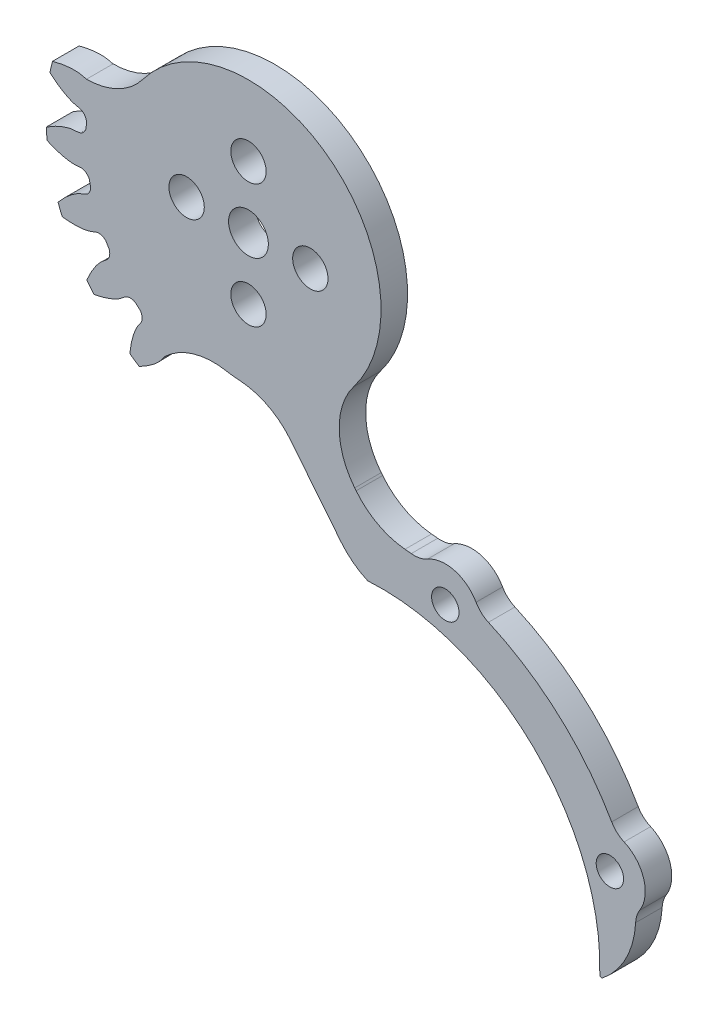
from build123d import *
from build123d.topology import SkipClean

# Parameters (mm, degrees)
SKETCH_1_R               = 23
EXTRUDE_1_DEPTH          = 3
CUT_EXTRUDE_1_DEPTH      = 33.664965942
PATTERN_CIRCULAR_1_COUNT = 21
SKETCH_4_R               = 2.1
CUT_EXTRUDE_2_DEPTH      = 10
SKETCH_5_R               = 2
CUT_EXTRUDE_3_DEPTH      = 10
SKETCH_10_R              = 30.47238685
CUT_EXTRUDE_5_DEPTH      = 3
CUT_EXTRUDE_6_DEPTH      = 3
EXTRUDE_2_DEPTH          = 3
CUT_EXTRUDE_7_DEPTH      = 10
SKETCH_14_R              = 1.55
CUT_EXTRUDE_8_DEPTH      = 10
FILLET_1_R               = 8
FILLET_2_R               = 8
FILLET_3_R               = 10
EXTRUDE_START            = -3
EXTRUDE_3_DEPTH          = 3
FILLET_5_R               = 3
FILLET_6_DEPTH           = 3
SKETCH_16_R              = 2.25
CUT_EXTRUDE_9_DEPTH      = 10
FILLET_7_R               = 0.2
SKETCH_18_R              = 1
CUT_EXTRUDE_10_DEPTH     = 1


with BuildPart() as part:
    # 草图1 → 凸台-拉伸1 (new body)
    with BuildSketch(Plane.XY):
        Circle(SKETCH_1_R)
    extrude(amount=EXTRUDE_1_DEPTH)

    # 草图2 → 切除-拉伸1 (cut, through all)
    with BuildSketch(Plane.XY):
        with BuildLine():
            ThreePointArc((0.379318728, 18.49611087), (0, 18.5), (-0.379318728, 18.49611087))
            add(Edge.make_bspline(
                [(-0.379318728, 18.49611087), (-1.198551585, 18.770207731), (-1.105588756, 19.339069889), (-1.212479371, 19.891707565), (-1.22485173, 19.949603647), (-1.240186203, 20.014925389), (-1.258774323, 20.0875763), (-1.280917681, 20.167448705), (-1.30691073, 20.254426612), (-1.337045923, 20.34838491), (-1.371611795, 20.449189724), (-1.410893244, 20.55669843), (-1.455171142, 20.670759774), (-1.504722148, 20.791213969), (-1.559818468, 20.917892808), (-1.620727631, 21.050619779), (-1.687712268, 21.189210182), (-1.76102989, 21.333471261), (-1.84093267, 21.483202333), (-1.927667235, 21.638194926), (-2.021474449, 21.798232922), (-2.122589211, 21.963092704), (-2.231240251, 22.132543311), (-2.347649931, 22.306346595), (-2.472034047, 22.484257387), (-2.604601644, 22.66602366), (-2.745554822, 22.851386709), (-2.895088556, 23.040081322), (-3.053390519, 23.231835969), (-3.220640907, 23.426372983), (-3.397012266, 23.623408757), (-3.582669333, 23.822653935), (-3.777768872, 24.023813614), (-3.98245952, 24.226587551), (-4.196881638, 24.430670364), (-4.421167165, 24.635751752), (-4.655439476, 24.841516702), (-4.899813249, 25.047645717), (-5.154394351, 25.253815031), (-5.419279639, 25.459696844), (-5.7905351, 25.736526212), (-6.078424351, 25.937901448), (-6.275082174, 26.069812755)],
                knots=[0, 0, 0, 0, 0.161234605, 0.166476889, 0.172525678, 0.179380972, 0.187042772, 0.195511076, 0.204785886, 0.214867201, 0.225755021, 0.237449346, 0.249950177, 0.263257512, 0.277371353, 0.292291699, 0.30801855, 0.324551907, 0.341891768, 0.360038135, 0.378991007, 0.398750384, 0.419316266, 0.440688653, 0.462867546, 0.485852944, 0.509644847, 0.534243255, 0.559648168, 0.585859587, 0.612877511, 0.64070194, 0.669332874, 0.698770313, 0.729014258, 0.760064707, 0.791921662, 0.824585122, 0.858055087, 0.892331558, 0.927414533, 1, 1, 1, 1], degree=3))
            ThreePointArc((-6.275082174, 26.069812755), (0, 26.814395264), (6.275082174, 26.069812755))
            add(Edge.make_bspline(
                [(0.379318728, 18.49611087), (1.198551585, 18.770207731), (1.105588756, 19.339069889), (1.212479371, 19.891707565), (1.22485173, 19.949603647), (1.240186203, 20.014925389), (1.258774323, 20.0875763), (1.280917681, 20.167448705), (1.30691073, 20.254426612), (1.337045923, 20.34838491), (1.371611795, 20.449189724), (1.410893244, 20.55669843), (1.455171142, 20.670759774), (1.504722148, 20.791213969), (1.559818468, 20.917892808), (1.620727631, 21.050619779), (1.687712268, 21.189210182), (1.76102989, 21.333471261), (1.84093267, 21.483202333), (1.927667235, 21.638194926), (2.021474449, 21.798232922), (2.122589211, 21.963092704), (2.231240251, 22.132543311), (2.347649931, 22.306346595), (2.472034047, 22.484257387), (2.604601644, 22.66602366), (2.745554822, 22.851386709), (2.895088556, 23.040081322), (3.053390519, 23.231835969), (3.220640907, 23.426372983), (3.397012266, 23.623408757), (3.582669333, 23.822653935), (3.777768872, 24.023813614), (3.98245952, 24.226587551), (4.196881638, 24.430670364), (4.421167165, 24.635751752), (4.655439476, 24.841516702), (4.899813249, 25.047645717), (5.154394351, 25.253815031), (5.419279639, 25.459696844), (5.7905351, 25.736526212), (6.078424351, 25.937901448), (6.275082174, 26.069812755)],
                knots=[0, 0, 0, 0, 0.161234605, 0.166476889, 0.172525678, 0.179380972, 0.187042772, 0.195511076, 0.204785886, 0.214867201, 0.225755021, 0.237449346, 0.249950177, 0.263257512, 0.277371353, 0.292291699, 0.30801855, 0.324551907, 0.341891768, 0.360038135, 0.378991007, 0.398750384, 0.419316266, 0.440688653, 0.462867546, 0.485852944, 0.509644847, 0.534243255, 0.559648168, 0.585859587, 0.612877511, 0.64070194, 0.669332874, 0.698770313, 0.729014258, 0.760064707, 0.791921662, 0.824585122, 0.858055087, 0.892331558, 0.927414533, 1, 1, 1, 1], degree=3))
        make_face()
    cut_extrude_1 = extrude(amount=CUT_EXTRUDE_1_DEPTH, mode=Mode.SUBTRACT)

    # 阵列(圆周)1: 切除-拉伸1 ×21 about axis
    pattern_circular_1_axis = Axis((0, 0, -0.15), (0, 0, 1))
    for i in range(1, PATTERN_CIRCULAR_1_COUNT):
        add(cut_extrude_1.rotate(pattern_circular_1_axis, i * 360 / PATTERN_CIRCULAR_1_COUNT), mode=Mode.SUBTRACT)

    # 草图4 → 切除-拉伸2 (cut)
    with BuildSketch(Plane(origin=(0, 0, 0), x_dir=(-1, 0, 0), z_dir=(0, 0, -1))):
        Circle(SKETCH_4_R)
    extrude(amount=-CUT_EXTRUDE_2_DEPTH, mode=Mode.SUBTRACT)

    # 草图5 → 切除-拉伸3 (cut)
    with BuildSketch(Plane(origin=(0, 0, 0), x_dir=(-1, 0, 0), z_dir=(0, 0, -1))):
        with Locations((0, 7)):
            Circle(SKETCH_5_R)
        with Locations((7, 0)):
            Circle(SKETCH_5_R)
        with Locations((0, -7)):
            Circle(SKETCH_5_R)
        with Locations((-7, 0)):
            Circle(SKETCH_5_R)
    extrude(amount=-CUT_EXTRUDE_3_DEPTH, mode=Mode.SUBTRACT)

    # 草图10 → 切除-拉伸5 (cut)
    with BuildSketch(Plane(origin=(0, 0, 0), x_dir=(-1, 0, 0), z_dir=(0, 0, -1))):
        Circle(SKETCH_10_R)
        with BuildLine():
            ThreePointArc((5.799299087, 17.462191446), (5.423495209, 17.582539626), (5.04519693, 17.694801156))
            add(Edge.make_bspline(
                [(5.04519693, 17.694801156), (4.959309688, 17.756385518), (4.877646553, 17.822179648), (4.731987564, 17.971375216), (4.666440633, 18.055974702), (4.56655718, 18.242766467), (4.532957454, 18.344428107), (4.500758672, 18.554416434), (4.501841681, 18.660685726), (4.532974323, 18.979299828), (4.588542547, 19.189738719), (4.626274776, 19.614771365), (4.624151676, 19.828475731), (4.598651768, 20.257087475), (4.574045478, 20.471915252), (4.507855373, 20.89517708), (4.466103805, 21.104720101), (4.319361805, 21.728166575), (4.193050353, 22.136927542), (4.043750319, 22.540143818)],
                knots=[0, 0, 0, 0, 0.0625, 0.0625, 0.125, 0.125, 0.1875, 0.1875, 0.25, 0.25, 0.375, 0.375, 0.5, 0.5, 0.625, 0.625, 0.75, 0.75, 1, 1, 1, 1], degree=3))
            ThreePointArc((4.043750319, 22.540143818), (3.413067828, 22.644225931), (2.779726049, 22.730664819))
            add(Edge.make_bspline(
                [(2.779726049, 22.730664819), (2.519307935, 22.390806119), (2.278621276, 22.038423036), (1.846616689, 21.302320466), (1.653845637, 20.916867571), (1.429843368, 20.322205766), (1.365002114, 20.120929317), (1.296774474, 19.809985265), (1.281742042, 19.703939474), (1.255738717, 19.490584791), (1.243580624, 19.383775953), (1.202593621, 19.174488053), (1.173391994, 19.071112697), (1.082561974, 18.87678796), (1.021711992, 18.788376558), (0.870947674, 18.635443785), (0.783830889, 18.572950972), (0.595733957, 18.469416375), (0.496367024, 18.429823928), (0.394581215, 18.395768689)],
                knots=[0, 0, 0, 0, 0.25, 0.25, 0.5, 0.5, 0.625, 0.625, 0.6875, 0.6875, 0.75, 0.75, 0.8125, 0.8125, 0.875, 0.875, 0.9375, 0.9375, 1, 1, 1, 1], degree=3))
            ThreePointArc((0.394581215, 18.395768689), (0, 18.4), (-0.394581215, 18.395768689))
            add(Edge.make_bspline(
                [(-0.394581215, 18.395768689), (-0.494805037, 18.429301323), (-0.592233268, 18.468101772), (-0.775397203, 18.567735259), (-0.862968204, 18.629255929), (-1.013471954, 18.778307897), (-1.075544233, 18.865549302), (-1.168207659, 19.056717679), (-1.198496189, 19.158584946), (-1.262659838, 19.472220426), (-1.271588307, 19.689689129), (-1.360812987, 20.106960537), (-1.425832231, 20.310544822), (-1.576534779, 20.71259832), (-1.66336948, 20.91062907), (-1.851377557, 21.295576687), (-1.95303811, 21.483503809), (-2.277024849, 22.035999341), (-2.518209048, 22.389369251), (-2.779726184, 22.730664802)],
                knots=[0, 0, 0, 0, 0.0625, 0.0625, 0.125, 0.125, 0.1875, 0.1875, 0.25, 0.25, 0.375, 0.375, 0.5, 0.5, 0.625, 0.625, 0.75, 0.75, 1, 1, 1, 1], degree=3))
            ThreePointArc((-2.779726184, 22.730664802), (-3.413067963, 22.64422591), (-4.043750453, 22.540143794))
            add(Edge.make_bspline(
                [(-4.043750453, 22.540143794), (-4.19242381, 22.138624476), (-4.3185507, 21.730953148), (-4.514392493, 20.900217961), (-4.584985033, 20.475069392), (-4.623755865, 19.840800915), (-4.62638913, 19.629354319), (-4.599933239, 19.312114189), (-4.583040277, 19.206348827), (-4.54500095, 18.99480828), (-4.525136436, 18.889160998), (-4.50261381, 18.67709004), (-4.500047669, 18.569700031), (-4.529564145, 18.357235979), (-4.561651014, 18.2548166), (-4.66063957, 18.064239638), (-4.725465921, 17.978845082), (-4.874688876, 17.824467693), (-4.957971137, 17.75734531), (-5.04519693, 17.694801156)],
                knots=[0, 0, 0, 0, 0.25, 0.25, 0.5, 0.5, 0.625, 0.625, 0.6875, 0.6875, 0.75, 0.75, 0.8125, 0.8125, 0.875, 0.875, 0.9375, 0.9375, 1, 1, 1, 1], degree=3))
            ThreePointArc((-5.04519693, 17.694801156), (-5.423495209, 17.582539626), (-5.799299087, 17.462191446))
            add(Edge.make_bspline(
                [(-5.799299087, 17.462191446), (-5.904954163, 17.464692829), (-6.009490565, 17.473052008), (-6.213884525, 17.51427054), (-6.315698528, 17.547246015), (-6.503449658, 17.645314262), (-6.588479095, 17.710383651), (-6.733373614, 17.865745929), (-6.792342414, 17.954159819), (-6.946101132, 18.234948787), (-7.018732959, 18.440124253), (-7.226986544, 18.812558026), (-7.349124687, 18.987932875), (-7.611639292, 19.327703908), (-7.752986759, 19.49134173), (-8.046107468, 19.803770851), (-8.198644019, 19.953383924), (-8.671087853, 20.385836862), (-9.005714524, 20.652417248), (-9.356211817, 20.901466466)],
                knots=[0, 0, 0, 0, 0.0625, 0.0625, 0.125, 0.125, 0.1875, 0.1875, 0.25, 0.25, 0.375, 0.375, 0.5, 0.5, 0.625, 0.625, 0.75, 0.75, 1, 1, 1, 1], degree=3))
            ThreePointArc((-9.356211817, 20.901466466), (-9.935937687, 20.632187045), (-10.507921982, 20.346832078))
            add(Edge.make_bspline(
                [(-10.507921982, 20.346832078), (-10.531640302, 19.919328896), (-10.532000494, 19.492592707), (-10.474278092, 18.641039372), (-10.416419662, 18.213971445), (-10.2665141, 17.596453833), (-10.206705397, 17.393625047), (-10.087916698, 17.098277017), (-10.040599355, 17.002189802), (-9.941897338, 16.811259695), (-9.891775265, 16.716161195), (-9.807744244, 16.520150615), (-9.773638349, 16.418288026), (-9.739218612, 16.206563021), (-9.739691309, 16.099236078), (-9.778108536, 15.887948526), (-9.814884347, 15.787239908), (-9.91197421, 15.595736835), (-9.971771804, 15.507048634), (-10.036687187, 15.421572887)],
                knots=[0, 0, 0, 0, 0.25, 0.25, 0.5, 0.5, 0.625, 0.625, 0.6875, 0.6875, 0.75, 0.75, 0.8125, 0.8125, 0.875, 0.875, 0.9375, 0.9375, 1, 1, 1, 1], degree=3))
            ThreePointArc((-10.036687187, 15.421572887), (-10.365089068, 15.202793447), (-10.688723785, 14.977021862))
            add(Edge.make_bspline(
                [(-10.688723785, 14.977021862), (-10.790422198, 14.948269734), (-10.892778252, 14.925444893), (-11.100240938, 14.904586025), (-11.207251323, 14.906086287), (-11.41556732, 14.94445702), (-11.515998677, 14.981572692), (-11.700249774, 15.087324251), (-11.782659207, 15.154428801), (-12.012350858, 15.377421925), (-12.142232387, 15.552073414), (-12.451010631, 15.846577178), (-12.619415163, 15.978159765), (-12.970416252, 16.225458185), (-13.153717142, 16.340163141), (-13.52590542, 16.552313067), (-13.715764427, 16.650318313), (-14.294686648, 16.924303316), (-14.693022743, 17.08040734), (-15.101356971, 17.21508111)],
                knots=[0, 0, 0, 0, 0.0625, 0.0625, 0.125, 0.125, 0.1875, 0.1875, 0.25, 0.25, 0.375, 0.375, 0.5, 0.5, 0.625, 0.625, 0.75, 0.75, 1, 1, 1, 1], degree=3))
            ThreePointArc((-15.101356971, 17.21508111), (-15.575955745, 16.786887819), (-16.038418529, 16.345615042))
            add(Edge.make_bspline(
                [(-16.038418529, 16.345615042), (-15.935074336, 15.930113528), (-15.809635826, 15.522229862), (-15.503478116, 14.72552263), (-15.322309693, 14.334482204), (-14.997047502, 13.788584607), (-14.880111099, 13.61239586), (-14.679544488, 13.365182897), (-14.606007118, 13.287311599), (-14.455412517, 13.133956912), (-14.379486453, 13.057857111), (-14.241413561, 12.89532331), (-14.17879837, 12.808039079), (-14.083500765, 12.615865818), (-14.05231729, 12.513167779), (-14.026749648, 12.299943464), (-14.032207226, 12.192869188), (-14.068537138, 11.981256319), (-14.099536786, 11.878882635), (-14.136373742, 11.778070191)],
                knots=[0, 0, 0, 0, 0.25, 0.25, 0.5, 0.5, 0.625, 0.625, 0.6875, 0.6875, 0.75, 0.75, 0.8125, 0.8125, 0.875, 0.875, 0.9375, 0.9375, 1, 1, 1, 1], degree=3))
            ThreePointArc((-14.136373742, 11.778070191), (-14.385699277, 11.472212354), (-14.628408469, 11.161078159))
            add(Edge.make_bspline(
                [(-14.628408469, 11.161078159), (-14.717113868, 11.103627275), (-14.80819479, 11.051646501), (-15.000292232, 10.970563633), (-15.102990655, 10.940455378), (-15.313361729, 10.915719189), (-15.420271239, 10.921583254), (-15.627507396, 10.968327604), (-15.726035022, 11.00816028), (-16.011250495, 11.153543642), (-16.186841182, 11.282152603), (-16.568707784, 11.472558406), (-16.768415223, 11.54865704), (-17.176714807, 11.681509299), (-17.385682032, 11.737089349), (-17.803867317, 11.830109629), (-18.014178976, 11.867798852), (-18.648139804, 11.958971149), (-19.074791413, 11.990728285), (-19.504680287, 11.99906025)],
                knots=[0, 0, 0, 0, 0.0625, 0.0625, 0.125, 0.125, 0.1875, 0.1875, 0.25, 0.25, 0.375, 0.375, 0.5, 0.5, 0.625, 0.625, 0.75, 0.75, 1, 1, 1, 1], degree=3))
            ThreePointArc((-19.504680287, 11.99906025), (-19.831981781, 11.449999941), (-20.143831207, 10.892018377))
            add(Edge.make_bspline(
                [(-20.143831207, 10.892018377), (-19.922607085, 10.525437665), (-19.682515635, 10.172648776), (-19.155126074, 9.50157858), (-18.866745266, 9.181311313), (-18.395027421, 8.755539128), (-18.231353629, 8.621645563), (-17.96683033, 8.444533625), (-17.873607051, 8.391797451), (-17.684500858, 8.28964442), (-17.589517165, 8.23930512), (-17.409670786, 8.124689939), (-17.324109934, 8.059739653), (-17.176402071, 7.904193573), (-17.116333212, 7.81524961), (-17.029052498, 7.619034448), (-17.002706915, 7.515108532), (-16.975048802, 7.3021886), (-16.97449605, 7.195225785), (-16.979981454, 7.088034271)],
                knots=[0, 0, 0, 0, 0.25, 0.25, 0.5, 0.5, 0.625, 0.625, 0.6875, 0.6875, 0.75, 0.75, 0.8125, 0.8125, 0.875, 0.875, 0.9375, 0.9375, 1, 1, 1, 1], degree=3))
            ThreePointArc((-16.979981454, 7.088034271), (-17.128076975, 6.722274848), (-17.268294864, 6.353423683))
            add(Edge.make_bspline(
                [(-17.268294864, 6.353423683), (-17.336125386, 6.272378804), (-17.407838236, 6.195860817), (-17.567501732, 6.061758519), (-17.656762989, 6.002716998), (-17.850496747, 5.917071806), (-17.954385031, 5.891163215), (-18.166192405, 5.874746915), (-18.272083613, 5.883768409), (-18.587480261, 5.93862406), (-18.793178104, 6.009763022), (-19.214202539, 6.079152473), (-19.427468003, 6.093005457), (-19.856786873, 6.099607048), (-20.072852778, 6.091123662), (-20.499877473, 6.056749034), (-20.711954668, 6.030773381), (-21.344623902, 5.931031915), (-21.761681157, 5.835620401), (-22.174927165, 5.71687023)],
                knots=[0, 0, 0, 0, 0.0625, 0.0625, 0.125, 0.125, 0.1875, 0.1875, 0.25, 0.25, 0.375, 0.375, 0.5, 0.5, 0.625, 0.625, 0.75, 0.75, 1, 1, 1, 1], degree=3))
            ThreePointArc((-22.174927165, 5.71687023), (-22.325849204, 5.095729321), (-22.459376082, 4.47061808))
            add(Edge.make_bspline(
                [(-22.459376082, 4.47061808), (-22.139928766, 4.185530476), (-21.806517554, 3.919183205), (-21.104757019, 3.433377577), (-20.734787728, 3.212340621), (-20.158528428, 2.944525575), (-19.962660382, 2.864824223), (-19.657684451, 2.773550482), (-19.55305856, 2.750635272), (-19.342243691, 2.708760642), (-19.236642088, 2.688654711), (-19.031002361, 2.632142212), (-18.930098304, 2.595296989), (-18.743104675, 2.490199042), (-18.659487814, 2.422912217), (-18.518249303, 2.261140786), (-18.462441478, 2.169597503), (-18.373252887, 1.974289378), (-18.341196849, 1.872241548), (-18.314843298, 1.768195401)],
                knots=[0, 0, 0, 0, 0.25, 0.25, 0.5, 0.5, 0.625, 0.625, 0.6875, 0.6875, 0.75, 0.75, 0.8125, 0.8125, 0.875, 0.875, 0.9375, 0.9375, 1, 1, 1, 1], degree=3))
            ThreePointArc((-18.314843298, 1.768195401), (-18.348549868, 1.375033722), (-18.37381748, 0.98123963))
            add(Edge.make_bspline(
                [(-18.37381748, 0.98123963), (-18.414746085, 0.883801951), (-18.460718861, 0.78954571), (-18.57376161, 0.614339559), (-18.641654446, 0.531610869), (-18.801536793, 0.392666626), (-18.893172921, 0.337287472), (-19.090731499, 0.259169182), (-19.19457739, 0.236577895), (-19.512130836, 0.196031669), (-19.729658678, 0.203379624), (-20.152431079, 0.145587165), (-20.360304995, 0.095963601), (-20.772496286, -0.024272057), (-20.976462467, -0.096065094), (-21.374383553, -0.254780292), (-21.569382295, -0.34211277), (-22.144544497, -0.623905533), (-22.514950031, -0.838007965), (-22.874834451, -1.073288798)],
                knots=[0, 0, 0, 0, 0.0625, 0.0625, 0.125, 0.125, 0.1875, 0.1875, 0.25, 0.25, 0.375, 0.375, 0.5, 0.5, 0.625, 0.625, 0.75, 0.75, 1, 1, 1, 1], degree=3))
            ThreePointArc((-22.874834451, -1.073288798), (-22.83596695, -1.711319211), (-22.779306831, -2.348016251))
            add(Edge.make_bspline(
                [(-22.779306831, -2.348016251), (-22.390020616, -2.526279464), (-21.992914693, -2.682518994), (-21.179137687, -2.939894092), (-20.760453306, -3.042060633), (-20.13085572, -3.128121997), (-19.920197156, -3.146549322), (-19.601867042, -3.143874792), (-19.49513501, -3.134932921), (-19.281343289, -3.112808405), (-19.174506942, -3.100894467), (-18.96134586, -3.094282902), (-18.854064367, -3.099749202), (-18.644400176, -3.145060602), (-18.544665038, -3.18471156), (-18.362018391, -3.297665158), (-18.281707096, -3.368691784), (-18.138912822, -3.529034119), (-18.078201818, -3.617099567), (-18.022350941, -3.70875539)],
                knots=[0, 0, 0, 0, 0.25, 0.25, 0.5, 0.5, 0.625, 0.625, 0.6875, 0.6875, 0.75, 0.75, 0.8125, 0.8125, 0.875, 0.875, 0.9375, 0.9375, 1, 1, 1, 1], degree=3))
            ThreePointArc((-18.022350941, -3.70875539), (-17.938673584, -4.094385185), (-17.846745781, -4.478131869))
            add(Edge.make_bspline(
                [(-17.846745781, -4.478131869), (-17.857135782, -4.583304584), (-17.873283603, -4.686923998), (-17.92966126, -4.887666167), (-17.970153098, -4.986731218), (-18.081977786, -5.166628708), (-18.153219486, -5.246557744), (-18.31897532, -5.37943687), (-18.411548731, -5.431633603), (-18.703042959, -5.563978996), (-18.913072496, -5.621074947), (-19.300027679, -5.800914202), (-19.484039539, -5.909605043), (-19.842478244, -6.145994483), (-20.016221411, -6.274718044), (-20.349681855, -6.54367127), (-20.51027565, -6.684600699), (-20.976825134, -7.123406236), (-21.267666789, -7.437175646), (-21.542212311, -7.768081406)],
                knots=[0, 0, 0, 0, 0.0625, 0.0625, 0.125, 0.125, 0.1875, 0.1875, 0.25, 0.25, 0.375, 0.375, 0.5, 0.5, 0.625, 0.625, 0.75, 0.75, 1, 1, 1, 1], degree=3))
            ThreePointArc((-21.542212311, -7.768081406), (-21.317008819, -8.366309521), (-21.075196202, -8.958019035))
            add(Edge.make_bspline(
                [(-21.075196202, -8.958019035), (-20.650660878, -9.013618387), (-20.225144847, -9.045867607), (-19.371659027, -9.051943269), (-18.941461503, -9.02616145), (-18.314468138, -8.922822202), (-18.107736994, -8.878338151), (-17.804337725, -8.781952995), (-17.70498316, -8.741948568), (-17.507210922, -8.657790766), (-17.408632709, -8.614915565), (-17.206890569, -8.5457674), (-17.102764071, -8.519369073), (-16.889058902, -8.50086781), (-16.782067391, -8.509359738), (-16.574241565, -8.563459081), (-16.47656281, -8.607658024), (-16.292850752, -8.718787447), (-16.208879221, -8.785045512), (-16.128493614, -8.856166989)],
                knots=[0, 0, 0, 0, 0.25, 0.25, 0.5, 0.5, 0.625, 0.625, 0.6875, 0.6875, 0.75, 0.75, 0.8125, 0.8125, 0.875, 0.875, 0.9375, 0.9375, 1, 1, 1, 1], degree=3))
            ThreePointArc((-16.128493614, -8.856166989), (-15.93486743, -9.2), (-15.7339124, -9.5396017))
            add(Edge.make_bspline(
                [(-15.7339124, -9.5396017), (-15.712840601, -9.643164393), (-15.69772866, -9.746939941), (-15.692431823, -9.955381305), (-15.701924787, -10.061980352), (-15.755755702, -10.266846407), (-15.800272835, -10.36422328), (-15.919497793, -10.540056349), (-15.992573169, -10.61722062), (-16.232107638, -10.829605709), (-16.415976825, -10.946072341), (-16.732732124, -11.231978885), (-16.876531665, -11.390079344), (-17.149368934, -11.721618328), (-17.277451244, -11.89583476), (-17.51682162, -12.25112834), (-17.628741005, -12.433132522), (-17.945222802, -12.989961035), (-18.130658022, -13.375517633), (-18.295470072, -13.772645892)],
                knots=[0, 0, 0, 0, 0.0625, 0.0625, 0.125, 0.125, 0.1875, 0.1875, 0.25, 0.25, 0.375, 0.375, 0.5, 0.5, 0.625, 0.625, 0.75, 0.75, 1, 1, 1, 1], degree=3))
            ThreePointArc((-18.295470072, -13.772645892), (-17.903940906, -14.277916516), (-17.498461904, -14.772062516))
            add(Edge.make_bspline(
                [(-17.498461904, -14.772062516), (-17.076399296, -14.700057761), (-16.660282124, -14.605451187), (-15.842923453, -14.359687562), (-15.439437722, -14.208248211), (-14.870759691, -13.924690498), (-14.686324935, -13.821247674), (-14.424814869, -13.639716135), (-14.34166586, -13.57220372), (-14.177486035, -13.433490423), (-14.095925063, -13.363463608), (-13.923527539, -13.237922963), (-13.831808133, -13.182005615), (-13.633050628, -13.101335607), (-13.52830941, -13.077913962), (-13.313770641, -13.068352085), (-13.207403612, -13.081796073), (-12.999097393, -13.133838249), (-12.899326574, -13.172401611), (-12.801548851, -13.216669286)],
                knots=[0, 0, 0, 0, 0.25, 0.25, 0.5, 0.5, 0.625, 0.625, 0.6875, 0.6875, 0.75, 0.75, 0.8125, 0.8125, 0.875, 0.875, 0.9375, 0.9375, 1, 1, 1, 1], degree=3))
            ThreePointArc((-12.801548851, -13.216669286), (-12.515178375, -13.488154442), (-12.223051855, -13.753436056))
            add(Edge.make_bspline(
                [(-12.223051855, -13.753436056), (-12.172390578, -13.846186727), (-12.127361638, -13.940897497), (-12.060860954, -14.138517125), (-12.038511551, -14.243178376), (-12.02956558, -14.454809747), (-12.043402605, -14.560982095), (-12.105503025, -14.764145567), (-12.1525873, -14.859420991), (-12.31887832, -15.132974431), (-12.460249572, -15.298463171), (-12.678659889, -15.665032953), (-12.769469892, -15.858495112), (-12.932462935, -16.255724946), (-13.003503712, -16.459954354), (-13.127514914, -16.870018894), (-13.18081536, -17.076925959), (-13.319108673, -17.70230079), (-13.382660724, -18.12538618), (-13.423095028, -18.55345035)],
                knots=[0, 0, 0, 0, 0.0625, 0.0625, 0.125, 0.125, 0.1875, 0.1875, 0.25, 0.25, 0.375, 0.375, 0.5, 0.5, 0.625, 0.625, 0.75, 0.75, 1, 1, 1, 1], degree=3))
            ThreePointArc((-13.423095028, -18.55345035), (-12.900029274, -18.92086797), (-12.366912476, -19.273543416))
            add(Edge.make_bspline(
                [(-12.366912476, -19.273543416), (-11.984824699, -19.080332493), (-11.615080223, -18.867276334), (-10.906474604, -18.3915106), (-10.565552144, -18.127869766), (-10.105718986, -17.689288935), (-9.959968456, -17.536078687), (-9.763583909, -17.28553064), (-9.704028611, -17.196509011), (-9.588029297, -17.015565504), (-9.530732616, -16.924609265), (-9.402997985, -16.753830976), (-9.331835343, -16.67336311), (-9.165685978, -16.537692241), (-9.07250177, -16.484438138), (-8.870312769, -16.412064656), (-8.764708643, -16.393559134), (-8.550317185, -16.381889886), (-8.443612153, -16.38933202), (-8.337130293, -16.402812517)],
                knots=[0, 0, 0, 0, 0.25, 0.25, 0.5, 0.5, 0.625, 0.625, 0.6875, 0.6875, 0.75, 0.75, 0.8125, 0.8125, 0.875, 0.875, 0.9375, 0.9375, 1, 1, 1, 1], degree=3))
            ThreePointArc((-8.337130293, -16.402812517), (-7.9834608, -16.577827169), (-7.626119513, -16.745217263))
            add(Edge.make_bspline(
                [(-7.626119513, -16.745217263), (-7.550370234, -16.818914608), (-7.479425314, -16.896145131), (-7.357629661, -17.065383653), (-7.305423734, -17.158807496), (-7.234495765, -17.358399808), (-7.216423202, -17.46393375), (-7.21588119, -17.67637566), (-7.232790718, -17.781296598), (-7.311062602, -18.091711965), (-7.397374464, -18.291518413), (-7.498033084, -18.706180099), (-7.52778468, -18.917813994), (-7.566450851, -19.345439064), (-7.574137811, -19.56153477), (-7.571770898, -19.989934236), (-7.561716427, -20.203359583), (-7.509533289, -20.841713435), (-7.445555292, -21.264734624), (-7.358019084, -21.685699324)],
                knots=[0, 0, 0, 0, 0.0625, 0.0625, 0.125, 0.125, 0.1875, 0.1875, 0.25, 0.25, 0.375, 0.375, 0.5, 0.5, 0.625, 0.625, 0.75, 0.75, 1, 1, 1, 1], degree=3))
            ThreePointArc((-7.358019084, -21.685699324), (-6.749893429, -21.882617273), (-6.136508602, -22.062485403))
            add(Edge.make_bspline(
                [(-6.136508602, -22.062485403), (-5.828345833, -21.76523595), (-5.537827471, -21.452661181), (-5.000937624, -20.78916721), (-4.752870892, -20.436750541), (-4.4427408, -19.882116422), (-4.348625072, -19.692752153), (-4.234815672, -19.395449891), (-4.204145834, -19.292829011), (-4.146634079, -19.085732918), (-4.118692751, -18.981929117), (-4.046970796, -18.781087585), (-4.00268803, -18.683219123), (-3.883909906, -18.504602345), (-3.810562534, -18.426247645), (-3.638688681, -18.29749326), (-3.543230848, -18.248682523), (-3.341803772, -18.174338715), (-3.237645738, -18.149998356), (-3.131921122, -18.131493874)],
                knots=[0, 0, 0, 0, 0.25, 0.25, 0.5, 0.5, 0.625, 0.625, 0.6875, 0.6875, 0.75, 0.75, 0.8125, 0.8125, 0.875, 0.875, 0.9375, 0.9375, 1, 1, 1, 1], degree=3))
            ThreePointArc((-3.131921122, -18.131493874), (-2.742377698, -18.194487203), (-2.351572985, -18.24911243))
            add(Edge.make_bspline(
                [(-2.351572985, -18.24911243), (-2.25746636, -18.297208117), (-2.166909228, -18.350096123), (-2.000640684, -18.475915953), (-1.923216959, -18.549801269), (-1.796609254, -18.719619869), (-1.748232928, -18.815138253), (-1.685096644, -19.017982204), (-1.67032894, -19.12322597), (-1.653626888, -19.442921496), (-1.677210172, -19.659291972), (-1.651173134, -20.085201052), (-1.617222765, -20.296202084), (-1.528126404, -20.716226026), (-1.471776527, -20.924986977), (-1.343241809, -21.333656197), (-1.270725805, -21.534636047), (-1.032702916, -22.129248378), (-0.846879598, -22.514618078), (-0.639150855, -22.891078747)],
                knots=[0, 0, 0, 0, 0.0625, 0.0625, 0.125, 0.125, 0.1875, 0.1875, 0.25, 0.25, 0.375, 0.375, 0.5, 0.5, 0.625, 0.625, 0.75, 0.75, 1, 1, 1, 1], degree=3))
            ThreePointArc((-0.639150855, -22.891078747), (6.8e-08, -22.9), (0.639150991, -22.891078743))
            add(Edge.make_bspline(
                [(0.639150991, -22.891078743), (0.846007138, -22.516202678), (1.031485553, -22.131882938), (1.34895461, -21.339615083), (1.482123796, -20.929736344), (1.614994402, -20.308330614), (1.649112734, -20.09963817), (1.670234522, -19.781998304), (1.669293749, -19.674896489), (1.663207773, -19.460049206), (1.659311039, -19.352621266), (1.668647508, -19.139562142), (1.68211568, -19.032989127), (1.742968605, -18.827297325), (1.789961906, -18.730804186), (1.916248865, -18.55710929), (1.993078557, -18.482330387), (2.163643571, -18.351917793), (2.255999709, -18.297957688), (2.351572985, -18.24911243)],
                knots=[0, 0, 0, 0, 0.25, 0.25, 0.5, 0.5, 0.625, 0.625, 0.6875, 0.6875, 0.75, 0.75, 0.8125, 0.8125, 0.875, 0.875, 0.9375, 0.9375, 1, 1, 1, 1], degree=3))
            ThreePointArc((2.351572985, -18.24911243), (2.742377698, -18.194487203), (3.131921122, -18.131493874))
            add(Edge.make_bspline(
                [(3.131921122, -18.131493874), (3.236023306, -18.14971439), (3.338146252, -18.173560546), (3.534113997, -18.244782041), (3.629876083, -18.292563796), (3.800913874, -18.417519556), (3.875295513, -18.494535154), (3.995416134, -18.669757571), (4.040548894, -18.765972794), (4.150740831, -19.066542129), (4.191981604, -19.280251167), (4.342400794, -19.679563749), (4.43703649, -19.871183551), (4.64597878, -20.246285394), (4.761358561, -20.429162263), (5.004640209, -20.781789183), (5.133174381, -20.952465595), (5.535887642, -21.450502491), (5.827045065, -21.763978912), (6.136508733, -22.062485367)],
                knots=[0, 0, 0, 0, 0.0625, 0.0625, 0.125, 0.125, 0.1875, 0.1875, 0.25, 0.25, 0.375, 0.375, 0.5, 0.5, 0.625, 0.625, 0.75, 0.75, 1, 1, 1, 1], degree=3))
            ThreePointArc((6.136508733, -22.062485367), (6.749893559, -21.882617232), (7.358019213, -21.68569928))
            add(Edge.make_bspline(
                [(7.358019213, -21.68569928), (7.445188662, -21.266505987), (7.50914656, -20.844589773), (7.578986307, -19.993944507), (7.585425281, -19.563023225), (7.529230264, -18.930060509), (7.500319637, -18.720583129), (7.426877049, -18.410829355), (7.394409258, -18.308763071), (7.325266316, -18.105254724), (7.289877762, -18.003748087), (7.235999159, -17.79740261), (7.21745603, -17.691594522), (7.214976707, -17.477104315), (7.231440376, -17.371046577), (7.300919289, -17.167844723), (7.352294185, -17.073742088), (7.476841687, -16.898848439), (7.549189682, -16.820063181), (7.626119513, -16.745217263)],
                knots=[0, 0, 0, 0, 0.25, 0.25, 0.5, 0.5, 0.625, 0.625, 0.6875, 0.6875, 0.75, 0.75, 0.8125, 0.8125, 0.875, 0.875, 0.9375, 0.9375, 1, 1, 1, 1], degree=3))
            ThreePointArc((7.626119513, -16.745217263), (7.9834608, -16.577827169), (8.337130293, -16.402812517))
            add(Edge.make_bspline(
                [(8.337130293, -16.402812517), (8.441978101, -16.389538889), (8.546592788, -16.382224361), (8.754847141, -16.392519178), (8.860438705, -16.409951754), (9.060709124, -16.478941806), (9.154486942, -16.530611444), (9.320918654, -16.662643046), (9.392406228, -16.741280582), (9.586297013, -16.996016821), (9.688697418, -17.188075435), (9.950133356, -17.525310845), (10.097045582, -17.680523155), (10.407268361, -17.977373455), (10.571426045, -18.118116831), (10.907837982, -18.383369002), (11.080969497, -18.508576627), (11.612590289, -18.865785323), (11.983211202, -19.079514709), (12.36691259, -19.273543343)],
                knots=[0, 0, 0, 0, 0.0625, 0.0625, 0.125, 0.125, 0.1875, 0.1875, 0.25, 0.25, 0.375, 0.375, 0.5, 0.5, 0.625, 0.625, 0.75, 0.75, 1, 1, 1, 1], degree=3))
            ThreePointArc((12.36691259, -19.273543343), (12.900029386, -18.920867894), (13.423095138, -18.55345027))
            add(Edge.make_bspline(
                [(13.423095138, -18.55345027), (13.382832501, -18.127186913), (13.319586941, -17.705163331), (13.135591811, -16.871724221), (13.014728441, -16.458049641), (12.774460976, -15.869771455), (12.685090225, -15.678122124), (12.523608958, -15.403777424), (12.462499054, -15.315815708), (12.336442801, -15.141728905), (12.272706854, -15.055162883), (12.160400529, -14.873865754), (12.111493738, -14.778224105), (12.045902466, -14.57399389), (12.030373633, -14.467795248), (12.036870996, -14.253141813), (12.05822621, -14.148076877), (12.125689609, -13.944242242), (12.171601022, -13.847632246), (12.223051855, -13.753436056)],
                knots=[0, 0, 0, 0, 0.25, 0.25, 0.5, 0.5, 0.625, 0.625, 0.6875, 0.6875, 0.75, 0.75, 0.8125, 0.8125, 0.875, 0.875, 0.9375, 0.9375, 1, 1, 1, 1], degree=3))
            ThreePointArc((12.223051855, -13.753436056), (12.515178375, -13.488154442), (12.801548851, -13.216669286))
            add(Edge.make_bspline(
                [(12.801548851, -13.216669286), (12.897826094, -13.173080935), (12.99563705, -13.13525565), (13.197673696, -13.083709049), (13.303712465, -13.069243484), (13.515420606, -13.07613776), (13.620262032, -13.097870363), (13.818216648, -13.174979564), (13.90970705, -13.229052122), (14.170068636, -13.415320833), (14.324529949, -13.568663772), (14.673752904, -13.813857163), (14.859887863, -13.918870688), (15.243826476, -14.111092992), (15.442175934, -14.197197208), (15.841826481, -14.35150581), (16.044171845, -14.420119402), (16.657463329, -14.604760339), (17.074616436, -14.699751896), (17.498461992, -14.772062412)],
                knots=[0, 0, 0, 0, 0.0625, 0.0625, 0.125, 0.125, 0.1875, 0.1875, 0.25, 0.25, 0.375, 0.375, 0.5, 0.5, 0.625, 0.625, 0.75, 0.75, 1, 1, 1, 1], degree=3))
            ThreePointArc((17.498461992, -14.772062412), (17.903940991, -14.277916409), (18.295470153, -13.772645783))
            add(Edge.make_bspline(
                [(18.295470153, -13.772645783), (18.131352942, -13.377187731), (17.946523571, -12.992555429), (17.525042338, -12.250377197), (17.287615865, -11.890706121), (16.88462477, -11.399383563), (16.742734879, -11.242591166), (16.507563251, -11.02803227), (16.423241118, -10.961990907), (16.251472205, -10.832794025), (16.165052085, -10.768860389), (16.004296948, -10.628720652), (15.929372077, -10.551743624), (15.806496929, -10.37592015), (15.760355399, -10.27901682), (15.703293891, -10.071984703), (15.69273192, -9.965292948), (15.697116795, -9.750628928), (15.712512197, -9.644778416), (15.7339124, -9.5396017)],
                knots=[0, 0, 0, 0, 0.25, 0.25, 0.5, 0.5, 0.625, 0.625, 0.6875, 0.6875, 0.75, 0.75, 0.8125, 0.8125, 0.875, 0.875, 0.9375, 0.9375, 1, 1, 1, 1], degree=3))
            ThreePointArc((15.7339124, -9.5396017), (15.93486743, -9.2), (16.128493614, -8.856166989))
            add(Edge.make_bspline(
                [(16.128493614, -8.856166989), (16.207645638, -8.78613693), (16.289961928, -8.721161831), (16.467829026, -8.612353954), (16.56489299, -8.567275578), (16.769227656, -8.51146149), (16.875817068, -8.501326022), (17.087705452, -8.51666133), (17.191069359, -8.541364327), (17.494767476, -8.642614717), (17.687565132, -8.743616788), (18.093545111, -8.874981652), (18.302363896, -8.920465478), (18.725903713, -8.990979991), (18.940820724, -9.01479431), (19.368199178, -9.044448347), (19.581779116, -9.050371286), (20.222247651, -9.046038306), (20.64886707, -9.013851618), (21.075196255, -8.95801891)],
                knots=[0, 0, 0, 0, 0.0625, 0.0625, 0.125, 0.125, 0.1875, 0.1875, 0.25, 0.25, 0.375, 0.375, 0.5, 0.5, 0.625, 0.625, 0.75, 0.75, 1, 1, 1, 1], degree=3))
            ThreePointArc((21.075196255, -8.95801891), (21.317008869, -8.366309395), (21.542212357, -7.768081278))
            add(Edge.make_bspline(
                [(21.542212357, -7.768081278), (21.268823107, -7.438566715), (20.978832824, -7.12550196), (20.357315946, -6.540530399), (20.024422754, -6.266821182), (19.494515556, -5.916110417), (19.312714065, -5.808106645), (19.024748108, -5.672398054), (18.924706137, -5.634145107), (18.722486985, -5.561317857), (18.621061498, -5.52569739), (18.426141349, -5.439167078), (18.331855802, -5.387694416), (18.162614773, -5.255900372), (18.089960424, -5.176902639), (17.974410212, -4.995887553), (17.932869533, -4.897049009), (17.873786269, -4.690629444), (17.857297711, -4.584943699), (17.846745781, -4.478131869)],
                knots=[0, 0, 0, 0, 0.25, 0.25, 0.5, 0.5, 0.625, 0.625, 0.6875, 0.6875, 0.75, 0.75, 0.8125, 0.8125, 0.875, 0.875, 0.9375, 0.9375, 1, 1, 1, 1], degree=3))
            ThreePointArc((17.846745781, -4.478131869), (17.938673584, -4.094385185), (18.022350941, -3.70875539))
            add(Edge.make_bspline(
                [(18.022350941, -3.70875539), (18.07734474, -3.618506101), (18.136852203, -3.532154511), (18.274745479, -3.375753415), (18.354210079, -3.304067639), (18.533015238, -3.190504515), (18.6318817, -3.149401557), (18.838876639, -3.101600362), (18.944929714, -3.094738828), (19.264979452, -3.101974355), (19.478982532, -3.141661081), (19.905646433, -3.147525074), (20.118594578, -3.129437763), (20.544102227, -3.071978962), (20.756490472, -3.031387376), (21.173622381, -2.933751957), (21.379459379, -2.876457965), (21.990196526, -2.683536072), (22.388375248, -2.527031067), (22.779306845, -2.348016116)],
                knots=[0, 0, 0, 0, 0.0625, 0.0625, 0.125, 0.125, 0.1875, 0.1875, 0.25, 0.25, 0.375, 0.375, 0.5, 0.5, 0.625, 0.625, 0.75, 0.75, 1, 1, 1, 1], degree=3))
            ThreePointArc((22.779306845, -2.348016116), (22.835966961, -1.711319075), (22.874834457, -1.073288662))
            add(Edge.make_bspline(
                [(22.874834457, -1.073288662), (22.516465001, -0.838996403), (22.147080717, -0.625316373), (21.380752695, -0.249528773), (20.981971806, -0.086101678), (20.372233086, 0.092835102), (20.166673854, 0.142453639), (19.851500606, 0.187253623), (19.744627966, 0.19431921), (19.529926635, 0.204305809), (19.422507881, 0.208448071), (19.210742229, 0.233680361), (19.105473691, 0.255075085), (18.90490459, 0.33112922), (18.812193079, 0.38520206), (18.648421305, 0.52411613), (18.57959299, 0.606319225), (18.462291395, 0.78615305), (18.415383957, 0.882283386), (18.37381748, 0.98123963)],
                knots=[0, 0, 0, 0, 0.25, 0.25, 0.5, 0.5, 0.625, 0.625, 0.6875, 0.6875, 0.75, 0.75, 0.8125, 0.8125, 0.875, 0.875, 0.9375, 0.9375, 1, 1, 1, 1], degree=3))
            ThreePointArc((18.37381748, 0.98123963), (18.348549868, 1.375033722), (18.314843298, 1.768195401))
            add(Edge.make_bspline(
                [(18.314843298, 1.768195401), (18.340792432, 1.870644874), (18.372203566, 1.970700238), (18.457870599, 2.160797629), (18.512675057, 2.252721209), (18.650063085, 2.413942787), (18.732421879, 2.482361058), (18.916130963, 2.589051409), (19.015449925, 2.626867797), (19.323413461, 2.71429004), (19.539606852, 2.739444999), (19.949043715, 2.85960292), (20.147199843, 2.93965423), (20.536867102, 3.119980879), (20.727854953, 3.221371629), (21.097676317, 3.437621169), (21.277480854, 3.55304127), (21.804219937, 3.917410119), (22.138578035, 4.184327284), (22.459376055, 4.470618214)],
                knots=[0, 0, 0, 0, 0.0625, 0.0625, 0.125, 0.125, 0.1875, 0.1875, 0.25, 0.25, 0.375, 0.375, 0.5, 0.5, 0.625, 0.625, 0.75, 0.75, 1, 1, 1, 1], degree=3))
            ThreePointArc((22.459376055, 4.470618214), (22.325849174, 5.095729454), (22.174927131, 5.716870362))
            add(Edge.make_bspline(
                [(22.174927131, 5.716870362), (21.763420169, 5.835122422), (21.347463297, 5.930431318), (20.50441574, 6.06364458), (20.075180585, 6.102268337), (19.439788303, 6.093531815), (19.22873617, 6.080356293), (18.914360159, 6.030266994), (18.810152952, 6.005517412), (18.602046597, 5.951776006), (18.498179204, 5.924072006), (18.288384357, 5.885764275), (18.1814864, 5.875180044), (17.967410671, 5.888736528), (17.862879824, 5.913079866), (17.665438329, 5.997549796), (17.575438075, 6.055813335), (17.41034091, 6.193082396), (17.337182524, 6.271115721), (17.268294864, 6.353423683)],
                knots=[0, 0, 0, 0, 0.25, 0.25, 0.5, 0.5, 0.625, 0.625, 0.6875, 0.6875, 0.75, 0.75, 0.8125, 0.8125, 0.875, 0.875, 0.9375, 0.9375, 1, 1, 1, 1], degree=3))
            ThreePointArc((17.268294864, 6.353423683), (17.128076975, 6.722274848), (16.979981454, 7.088034271))
            add(Edge.make_bspline(
                [(16.979981454, 7.088034271), (16.974580228, 7.193580843), (16.975104018, 7.298449622), (17.000932916, 7.50535232), (17.026207614, 7.609345891), (17.109970983, 7.80390068), (17.168504167, 7.893554999), (17.31260404, 8.049654601), (17.396363962, 8.11506569), (17.664877384, 8.289377854), (17.864051355, 8.377139369), (18.219880918, 8.612642646), (18.385637988, 8.747545044), (18.704841211, 9.034716727), (18.857458559, 9.187897628), (19.147109127, 9.503546568), (19.28490478, 9.666837195), (19.68084272, 10.170277229), (19.921671011, 10.523889793), (20.143831142, 10.892018496)],
                knots=[0, 0, 0, 0, 0.0625, 0.0625, 0.125, 0.125, 0.1875, 0.1875, 0.25, 0.25, 0.375, 0.375, 0.5, 0.5, 0.625, 0.625, 0.75, 0.75, 1, 1, 1, 1], degree=3))
            ThreePointArc((20.143831142, 10.892018496), (19.831981713, 11.450000059), (19.504680216, 11.999060366))
            add(Edge.make_bspline(
                [(19.504680216, 11.999060366), (19.076599947, 11.990765013), (18.651030082, 11.959234162), (17.806171463, 11.838036502), (17.38462147, 11.748425031), (16.780033019, 11.552791486), (16.582240894, 11.477992606), (16.296595808, 11.337464678), (16.204313301, 11.283099038), (16.021293085, 11.170404787), (15.930206126, 11.113316146), (15.741023278, 11.014872203), (15.641994254, 10.973249474), (15.433433466, 10.923103752), (15.326371305, 10.915554576), (15.112803633, 10.938074842), (15.009628358, 10.967221855), (14.811405232, 11.049729193), (14.718496341, 11.102731903), (14.628408469, 11.161078159)],
                knots=[0, 0, 0, 0, 0.25, 0.25, 0.5, 0.5, 0.625, 0.625, 0.6875, 0.6875, 0.75, 0.75, 0.8125, 0.8125, 0.875, 0.875, 0.9375, 0.9375, 1, 1, 1, 1], degree=3))
            ThreePointArc((14.628408469, 11.161078159), (14.385699277, 11.472212354), (14.136373742, 11.778070191))
            add(Edge.make_bspline(
                [(14.136373742, 11.778070191), (14.10010208, 11.877335585), (14.069691984, 11.977699729), (14.033387735, 12.183023522), (14.026886906, 12.289846798), (14.049582873, 12.50044775), (14.079089518, 12.603371938), (14.170776272, 12.795010656), (14.231534719, 12.882204385), (14.43673943, 13.127918069), (14.6011965, 13.270488144), (14.871801745, 13.600411276), (14.990431513, 13.778178093), (15.210808093, 14.146678346), (15.311494218, 14.338038602), (15.495237265, 14.725040149), (15.578780287, 14.921692214), (15.80873626, 15.519470576), (15.934636093, 15.928358511), (16.038418432, 16.345615137)],
                knots=[0, 0, 0, 0, 0.0625, 0.0625, 0.125, 0.125, 0.1875, 0.1875, 0.25, 0.25, 0.375, 0.375, 0.5, 0.5, 0.625, 0.625, 0.75, 0.75, 1, 1, 1, 1], degree=3))
            ThreePointArc((16.038418432, 16.345615137), (15.575955645, 16.786887911), (15.101356869, 17.2150812))
            add(Edge.make_bspline(
                [(15.101356869, 17.2150812), (14.694740103, 17.080975511), (14.297370995, 16.925406568), (13.525770712, 16.560566931), (13.149362447, 16.350682604), (12.629298164, 15.985534934), (12.462340745, 15.855758907), (12.230807402, 15.637278873), (12.158649302, 15.558127799), (12.016977375, 15.396494081), (11.946764326, 15.315093376), (11.795003202, 15.165260398), (11.712642275, 15.096297533), (11.528127968, 14.986905273), (11.428047438, 14.94813436), (11.217330014, 14.906703937), (11.110147293, 14.904144584), (10.896411199, 14.924559061), (10.792007167, 14.947821633), (10.688723785, 14.977021862)],
                knots=[0, 0, 0, 0, 0.25, 0.25, 0.5, 0.5, 0.625, 0.625, 0.6875, 0.6875, 0.75, 0.75, 0.8125, 0.8125, 0.875, 0.875, 0.9375, 0.9375, 1, 1, 1, 1], degree=3))
            ThreePointArc((10.688723785, 14.977021862), (10.365089068, 15.202793447), (10.036687187, 15.421572887))
            add(Edge.make_bspline(
                [(10.036687187, 15.421572887), (9.972767984, 15.505736938), (9.914126073, 15.592678651), (9.818914469, 15.778179619), (9.781215741, 15.878340884), (9.74082767, 16.08627518), (9.738685979, 16.193323972), (9.769812845, 16.403473864), (9.802171162, 16.504702687), (9.925833824, 16.799985152), (10.04096126, 16.984695811), (10.202297723, 17.37972368), (10.263259414, 17.584559554), (10.365227925, 18.001645512), (10.405036422, 18.214181925), (10.466545572, 18.638149293), (10.488412798, 18.850689397), (10.531954208, 19.489690856), (10.531738829, 19.917522674), (10.507921861, 20.346832141)],
                knots=[0, 0, 0, 0, 0.0625, 0.0625, 0.125, 0.125, 0.1875, 0.1875, 0.25, 0.25, 0.375, 0.375, 0.5, 0.5, 0.625, 0.625, 0.75, 0.75, 1, 1, 1, 1], degree=3))
            ThreePointArc((10.507921861, 20.346832141), (9.935937565, 20.632187104), (9.356211693, 20.901466522))
            add(Edge.make_bspline(
                [(9.356211693, 20.901466522), (9.007188115, 20.653466377), (8.673327752, 20.387682324), (8.043545875, 19.811618313), (7.745724865, 19.500110274), (7.356394744, 18.997893452), (7.23510693, 18.824671446), (7.078258085, 18.547652216), (7.032635956, 18.450748629), (6.944900489, 18.25453731), (6.901800088, 18.156057351), (6.800945331, 17.968148655), (6.742570629, 17.877973307), (6.59849771, 17.719054492), (6.514291405, 17.652506807), (6.325147396, 17.550806971), (6.223480885, 17.516768661), (6.013223214, 17.47327636), (5.906600796, 17.464731813), (5.799299087, 17.462191446)],
                knots=[0, 0, 0, 0, 0.25, 0.25, 0.5, 0.5, 0.625, 0.625, 0.6875, 0.6875, 0.75, 0.75, 0.8125, 0.8125, 0.875, 0.875, 0.9375, 0.9375, 1, 1, 1, 1], degree=3))
        make_face(mode=Mode.SUBTRACT)
    extrude(amount=-CUT_EXTRUDE_5_DEPTH, mode=Mode.SUBTRACT)

    # 草图11 → 切除-拉伸6 (cut)
    with BuildSketch(Plane.XY.offset(3)):
        with BuildLine():
            ThreePointArc((29.690863414, 0), (13.274588611, 26.558099847), (-17.820901916, 23.74790149))
            Line((-17.820901916, 23.74790149), (-11.857784916, 15.227374325))
            Line((-11.857784916, 15.227374325), (-9.216018821, 11.834905876))
            ThreePointArc((-9.216018821, 11.834905876), (6.586338804, 13.476651704), (15, 0))
            ThreePointArc((15, 0), (12.933058977, -7.598419934), (7.301868601, -13.102775085))
            Line((7.301868601, -13.102775085), (14.467288827, -22.039019134))
            ThreePointArc((14.467288827, -22.039019134), (17.001306837, -22.098219446), (19.521282771, -22.3711173))
            ThreePointArc((19.521282771, -22.3711173), (27.029161203, -12.28705884), (29.690863414, 0))
        make_face()
        with BuildLine():
            Line((-7.353549897, -13.073840442), (-9.486182228, -16.865437045))
            Line((-9.486182228, -16.865437045), (-10.663085654, -27.710033826))
            ThreePointArc((-10.663085654, -27.710033826), (0.788915051, -29.680380444), (12.120074081, -27.10444935))
            Line((12.120074081, -27.10444935), (2.275113826, -14.826458009))
            ThreePointArc((2.275113826, -14.826458009), (-1.598481219, -14.914585405), (-5.36542201, -14.007578187))
            ThreePointArc((-5.36542201, -14.007578187), (-6.376600045, -13.577148886), (-7.353549897, -13.073840442))
        make_face()
    extrude(amount=-CUT_EXTRUDE_6_DEPTH, mode=Mode.SUBTRACT)

    # 草图11<3> → 凸台-拉伸2 (add)
    with BuildSketch(Plane.XY.offset(3)):
        with BuildLine():
            ThreePointArc((19.521282771, -22.3711173), (15.996717599, -25.013044524), (12.120074081, -27.10444935))
            Line((12.120074081, -27.10444935), (12.901066653, -28.07845227))
            ThreePointArc((12.901066653, -28.07845227), (31.918642909, -34.907082641), (39.017405593, -53.825485526))
            Line((39.017405593, -53.825485526), (44.891939623, -49.115060797))
            ThreePointArc((44.891939623, -49.115060797), (36.798890951, -31.386620309), (19.521282771, -22.3711173))
        make_face()
        with BuildLine():
            Line((2.275113826, -14.826458009), (12.120074081, -27.10444935))
            ThreePointArc((12.120074081, -27.10444935), (15.996717599, -25.013044524), (19.521282771, -22.3711173))
            ThreePointArc((19.521282771, -22.3711173), (17.001306837, -22.098219446), (14.467288827, -22.039019134))
            Line((14.467288827, -22.039019134), (7.301868601, -13.102775085))
            ThreePointArc((7.301868601, -13.102775085), (4.865430999, -14.188995073), (2.275113826, -14.826458009))
        make_face()
    extrude(amount=-EXTRUDE_2_DEPTH)

    # 草图12 → 切除-拉伸7 (cut)
    with BuildSketch(Plane.XY.offset(3)):
        with BuildLine():
            Line((-18.322339592, 5.893411501), (-14.279499944, 4.593025294))
            ThreePointArc((-14.279499944, 4.593025294), (-10.359120267, 10.848438934), (-3.929550952, 14.476140001))
            Line((-3.929550952, 14.476140001), (-13.461535565, 23.188961208))
            ThreePointArc((-13.461535565, 23.188961208), (-19.652778272, 18.240317098), (-24.126774546, 11.697846455))
            Line((-24.126774546, 11.697846455), (-18.322339592, 5.893411501))
        make_face()
    extrude(amount=-CUT_EXTRUDE_7_DEPTH, mode=Mode.SUBTRACT)

    # 草图14 → 切除-拉伸8 (cut)
    with BuildSketch(Plane(origin=(0, 0, 0), x_dir=(-1, 0, 0), z_dir=(0, 0, -1))):
        with Locations((-22.271629345, -25.295854607)):
            Circle(SKETCH_14_R)
        with Locations((-40.892294194, -42.101318767)):
            Circle(SKETCH_14_R)
    extrude(amount=-CUT_EXTRUDE_8_DEPTH, mode=Mode.SUBTRACT)

    # 圆角1
    fillet_1_edges = [part.edges().sort_by_distance(p)[0] for p in [
        (2.275113826, -14.826458009, 1.5),
        (7.301868601, -13.102775085, 1.5),
    ]]
    fillet(fillet_1_edges, radius=FILLET_1_R)

    # 圆角2
    fillet_2_edges = [part.edges().sort_by_distance(p)[0] for p in [
        (14.467288827, -22.039019134, 1.5),
        (12.901066653, -28.07845227, 1.5),
    ]]
    fillet(fillet_2_edges, radius=FILLET_2_R)

    # 圆角3
    fillet_3_edges = [part.edges().sort_by_distance(p)[0] for p in [
        (44.891939623, -49.115060797, 1.5),
    ]]
    fillet(fillet_3_edges, radius=FILLET_3_R)

    # 草图15 → 凸台-拉伸3 (add)
    with BuildSketch(Plane(origin=(0, 0, 0), x_dir=(-1, 0, 0), z_dir=(0, 0, -1)).offset(EXTRUDE_START)):
        with BuildLine():
            ThreePointArc((-41.63965337, -38.171757181), (-44.694559102, -40.859231183), (-43.81531705, -44.831875007))
            ThreePointArc((-43.81531705, -44.831875007), (-43.637118035, -43.264467391), (-43.214647307, -41.744585815))
            ThreePointArc((-43.214647307, -41.744585815), (-42.48533859, -39.932520633), (-41.63965337, -38.171757181))
        make_face()
        with BuildLine():
            ThreePointArc((-19.539889473, -22.373937895), (-23.316738618, -21.434799492), (-26.104223938, -24.150770033))
            ThreePointArc((-26.104223938, -24.150770033), (-22.872567177, -23.075747916), (-19.539889473, -22.373937895))
        make_face()
    extrude(amount=EXTRUDE_3_DEPTH)

    # 圆角5
    fillet_5_edges = [part.edges().sort_by_distance(p)[0] for p in [
        (41.63965337, -38.171757181, 1.5),
        (43.81531705, -44.831875007, 1.5),
        (19.539889473, -22.373937895, 1.5),
        (26.104223938, -24.150770033, 1.5),
    ]]
    fillet(fillet_5_edges, radius=FILLET_5_R)

    # 圆角6: read off the stored shape, not the designer's step
    # 圆角6 outline → 圆角6 (add)
    with BuildSketch(Plane.XY):
        with BuildLine():
            Line((-7.353549897, -13.073840442), (-9.486182228, -16.865437045))
            ThreePointArc((-9.486182228, -16.865437045), (-6.285065191, -14.99909391), (-2.586373371, -14.775340023))
            ThreePointArc((-2.586373371, -14.775340023), (-5.042250871, -14.127126606), (-7.353549897, -13.073840442))
        make_face()
        with BuildLine():
            ThreePointArc((-14.279499944, 4.593025294), (-13.305658483, 6.925276337), (-11.95406866, 9.060918412))
            ThreePointArc((-11.95406866, 9.060918412), (-14.766833733, 6.730524983), (-18.322339592, 5.893411501))
            Line((-18.322339592, 5.893411501), (-14.279499944, 4.593025294))
        make_face()
    extrude(amount=FILLET_6_DEPTH)

    # 草图16 → 切除-拉伸9 (cut)
    with BuildSketch(Plane(origin=(0, 0, 0), x_dir=(-1, 0, 0), z_dir=(0, 0, -1))):
        Circle(SKETCH_16_R)
    extrude(amount=-CUT_EXTRUDE_9_DEPTH, mode=Mode.SUBTRACT)

    # 草图17 → 切除-旋转1 (revolve, cut)
    with SkipClean():  # the faces are left unmerged after this step: merging them gives an invalid solid
        with BuildSketch(Plane.ZY.offset(-15.034247629)):
            with BuildLine():
                Line((32.048003912, -52.033661285), (-18.048003912, -52.033661285))
                ThreePointArc((-18.048003912, -52.033661285), (7, -26.985657372), (32.048003912, -52.033661285))
            make_face()
        revolve(axis=Axis((15.034247629, -52.033661285, 32.048003912), (0, 0, -1)), mode=Mode.SUBTRACT)

    # 圆角7
    fillet_7_edges = [part.edges().sort_by_distance(p)[0] for p in [
        (33.081438995, -36.137077255, 0),
        (14.086763875, -27.588349321, 1.621199259),
        (39.422598476, -53.500586467, 1.481035107),
    ]]
    fillet(fillet_7_edges, radius=FILLET_7_R)

    # 草图18 → 切除-拉伸10 (cut)
    with BuildSketch(Plane(origin=(0, 0, 0), x_dir=(-1, 0, 0), z_dir=(0, 0, -1))):
        with Locations((7.071067812, -7.071067812)):
            Circle(SKETCH_18_R)
    extrude(amount=-CUT_EXTRUDE_10_DEPTH, mode=Mode.SUBTRACT)


solid = part.part
